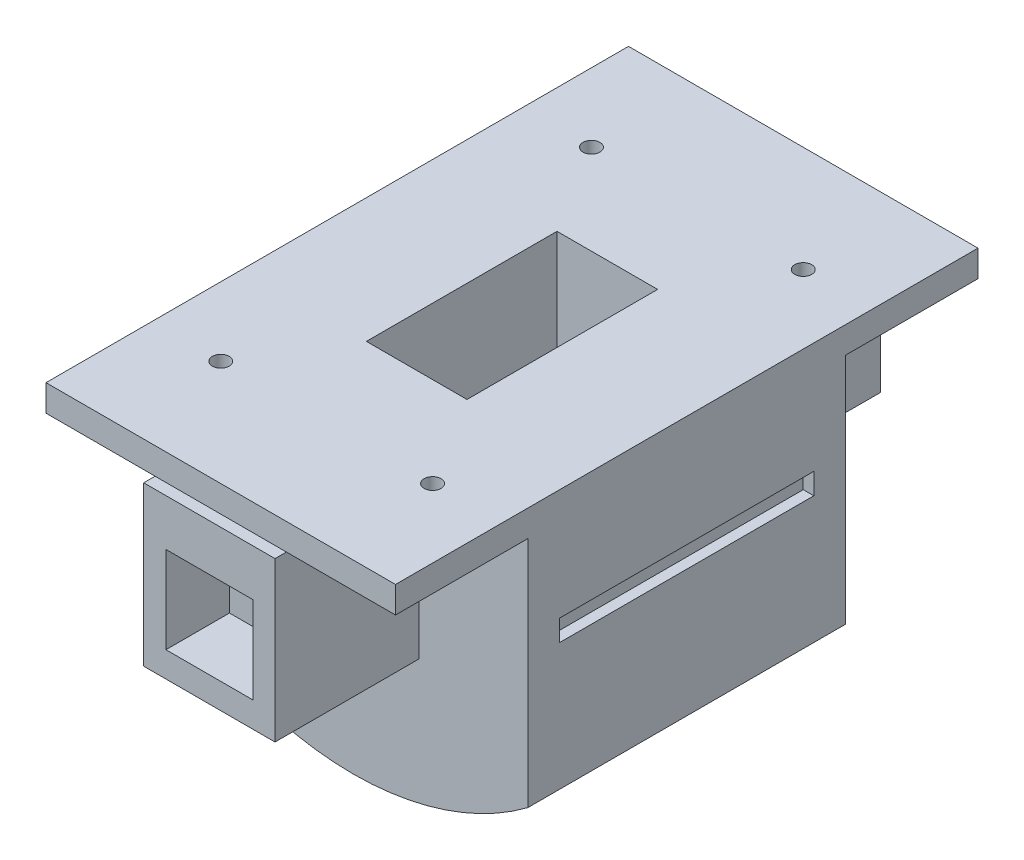
from build123d import *

# Parameters (mm, degrees)
BOSS_EXTRUDE1_DEPTH      = 30
BOSS_EXTRUDE1_DEPTH_BACK = 30
CUT_EXTRUDE1_DEPTH       = 18
CUT_EXTRUDE1_DEPTH_BACK  = 18
SKETCH2_W                = 19
SKETCH2_H                = 42
SKETCH3_W                = 21.854352608
SKETCH3_H                = 45
CUT_EXTRUDE2_DEPTH       = 99.234413522
SKETCH4_R                = 1.6
CUT_EXTRUDE3_DEPTH       = 84.366660003
SKETCH6_W                = 48
SKETCH6_H                = 4
CUT_EXTRUDE5_DEPTH       = 2
SKETCH9_W                = 22
SKETCH9_H                = 60
CUT_EXTRUDE7_DEPTH       = 84.366660003
SKETCH10_W               = 66
SKETCH10_H               = 110
SKETCH10_W_2             = 19
SKETCH10_H_2             = 36
BOSS_EXTRUDE2_DEPTH      = 5
SKETCH11_R               = 1.6
CUT_EXTRUDE8_DEPTH       = 88.82938005
SKETCH13_W               = 24.8
SKETCH13_H               = 30
BOSS_EXTRUDE3_DEPTH      = 27.15
SKETCH14_W               = 16.4
SKETCH14_H               = 16.4
CUT_EXTRUDE9_DEPTH       = 12


with BuildPart() as part:
    # Sketch1 → Boss-Extrude1 (new, two sides: drawn at the far end of the back side and taken through both)
    with BuildSketch(Plane.XY.offset(-BOSS_EXTRUDE1_DEPTH_BACK)):
        with BuildLine():
            Line((55, 0), (0, 0))
            Line((0, 0), (-55, 0))
            ThreePointArc((-55, 0), (0, -55), (55, 0))
        make_face()
    extrude(amount=BOSS_EXTRUDE1_DEPTH + BOSS_EXTRUDE1_DEPTH_BACK)

    # Sketch2 → Cut-Extrude1 (cut, two sides: drawn at the far end of the back side and taken through both)
    with BuildSketch(Plane.XY.offset(-CUT_EXTRUDE1_DEPTH_BACK)):
        with Locations((0, -21)):
            Rectangle(SKETCH2_W, SKETCH2_H)
    extrude(amount=CUT_EXTRUDE1_DEPTH + CUT_EXTRUDE1_DEPTH_BACK, mode=Mode.SUBTRACT)

    # Sketch3 → Cut-Extrude2 (cut, through all)
    with BuildSketch(Plane.XY.offset(30)):
        with Locations((-43.927176304, -26.5)):
            Rectangle(SKETCH3_W, SKETCH3_H)
        with Locations((43.927176304, -26.5)):
            Rectangle(SKETCH3_W, SKETCH3_H)
    extrude(amount=-CUT_EXTRUDE2_DEPTH, mode=Mode.SUBTRACT)

    # Sketch4 → Cut-Extrude3 (cut, through all)
    with BuildSketch(Plane(origin=(0, 0, 0), x_dir=(1, 0, 0), z_dir=(0, 1, 0))):
        with Locations((45, 20)):
            Circle(SKETCH4_R)
        with Locations((45, -20)):
            Circle(SKETCH4_R)
        with Locations((-45, -20)):
            Circle(SKETCH4_R)
        with Locations((-45, 20)):
            Circle(SKETCH4_R)
    extrude(amount=-CUT_EXTRUDE3_DEPTH, mode=Mode.SUBTRACT)

    # Sketch6 → Cut-Extrude5 (cut)
    with BuildSketch(Plane(origin=(33, 0, 0), x_dir=(0, 0, -1), z_dir=(1, 0, 0))):
        with Locations((0, -18)):
            Rectangle(SKETCH6_W, SKETCH6_H)
    extrude(amount=-CUT_EXTRUDE5_DEPTH, mode=Mode.SUBTRACT)

    # Sketch9 → Cut-Extrude7 (cut, through all)
    with BuildSketch(Plane(origin=(0, 0, 0), x_dir=(1, 0, 0), z_dir=(0, 1, 0))):
        with Locations((-44, 0)):
            Rectangle(SKETCH9_W, SKETCH9_H)
        with Locations((44, 0)):
            Rectangle(SKETCH9_W, SKETCH9_H)
    extrude(amount=-CUT_EXTRUDE7_DEPTH, mode=Mode.SUBTRACT)

    # Sketch10 → Boss-Extrude2 (add)
    with BuildSketch(Plane(origin=(0, 0, 0), x_dir=(1, 0, 0), z_dir=(0, 1, 0))):
        Rectangle(SKETCH10_W, SKETCH10_H)
        Rectangle(SKETCH10_W_2, SKETCH10_H_2, mode=Mode.SUBTRACT)
    extrude(amount=BOSS_EXTRUDE2_DEPTH)

    # Sketch11 → Cut-Extrude8 (cut, through all)
    with BuildSketch(Plane(origin=(0, 5, 0), x_dir=(1, 0, 0), z_dir=(0, 1, 0))):
        with Locations((-20, 35)):
            Circle(SKETCH11_R)
        with Locations((20, 35)):
            Circle(SKETCH11_R)
        with Locations((-20, -35)):
            Circle(SKETCH11_R)
        with Locations((20, -35)):
            Circle(SKETCH11_R)
    extrude(amount=-CUT_EXTRUDE8_DEPTH, mode=Mode.SUBTRACT)

    # Sketch13 → Boss-Extrude3 (add)
    with BuildSketch(Plane(origin=(0, 0, -30), x_dir=(-1, 0, 0), z_dir=(0, 0, -1))):
        with Locations((0, -15)):
            Rectangle(SKETCH13_W, SKETCH13_H)
    boss_extrude3 = extrude(amount=BOSS_EXTRUDE3_DEPTH)

    # Sketch14 → Cut-Extrude9 (cut)
    with BuildSketch(Plane(origin=(0, 0, -57.15), x_dir=(-1, 0, 0), z_dir=(0, 0, -1))):
        with Locations((0, -17)):
            Rectangle(SKETCH14_W, SKETCH14_H)
    cut_extrude9 = extrude(amount=-CUT_EXTRUDE9_DEPTH, mode=Mode.SUBTRACT)

    # Mirror2: Boss-Extrude3 across plane
    add(boss_extrude3.mirror(Plane(origin=(0, 0, 0), x_dir=(1, 0, 0), z_dir=(0, 0, -1))))

    # Mirror3: Cut-Extrude9 across plane
    add(cut_extrude9.mirror(Plane(origin=(0, 0, 0), x_dir=(1, 0, 0), z_dir=(0, 0, -1))), mode=Mode.SUBTRACT)


solid = part.part
